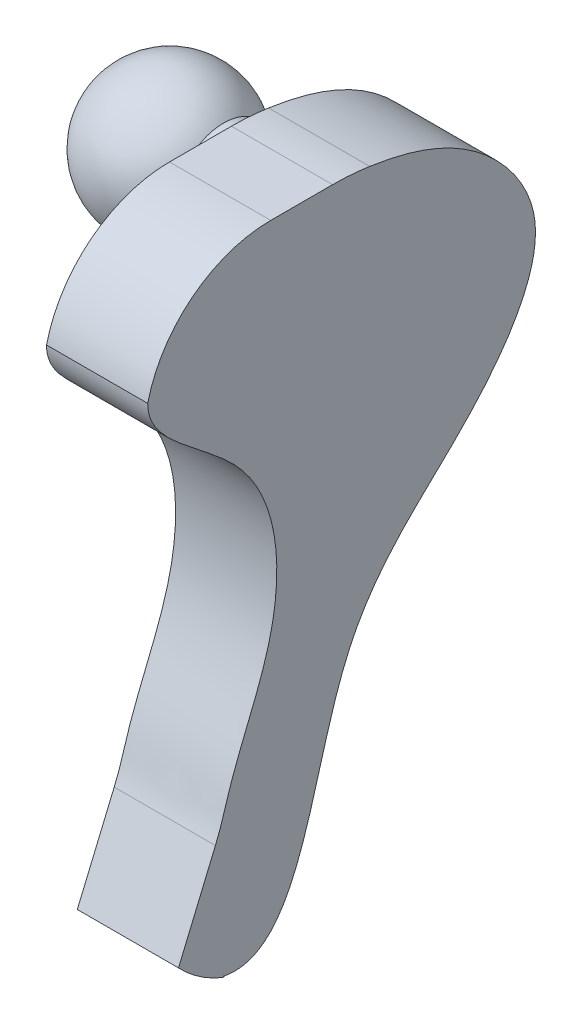
from build123d import *

# Parameters (mm, degrees)
BOSS_EXTRUDE1_DEPTH = 4
CUT_EXTRUDE3_START  = -10
CUT_EXTRUDE3_DEPTH  = 10
CUT_EXTRUDE4_DEPTH  = 10
FILLET4_START       = -1
FILLET4_DEPTH       = 6
SKETCH7_RX          = 1.83432271
SKETCH7_RY          = 1.648181576
BOSS_EXTRUDE2_DEPTH = 3
SKETCH8_R           = 1.941403724
BOSS_EXTRUDE3_DEPTH = 0.5
DOME1_FACE_RADIUS   = 1.941403724
DOME1_HEIGHT        = 5
CUT_EXTRUDE5_DEPTH  = 5


with BuildPart() as part:
    # Sketch1 → Boss-Extrude1 (new body)
    with BuildSketch(Plane(origin=(0, 0, 0), x_dir=(0, 0, -1), z_dir=(1, 0, 0))):
        with BuildLine():
            Line((6.442518848, 0), (13.409619329, 0))
            ThreePointArc((13.409619329, 0), (16.945153235, -1.464466094), (18.409619329, -5))
            Line((18.409619329, -5), (18.409619329, -20.34540211))
            ThreePointArc((18.409619329, -20.34540211), (16.945153235, -23.880936016), (13.409619329, -25.34540211))
            Line((13.409619329, -25.34540211), (6.442518848, -25.34540211))
            ThreePointArc((6.442518848, -25.34540211), (2.906984942, -23.880936016), (1.442518848, -20.34540211))
            Line((1.442518848, -20.34540211), (1.442518848, -5))
            ThreePointArc((1.442518848, -5), (2.906984942, -1.464466094), (6.442518848, 0))
        make_face()
    extrude(amount=BOSS_EXTRUDE1_DEPTH)

    # Sketch2 → Cut-Extrude3 (cut)
    with BuildSketch(Plane(origin=(4, 0, 0), x_dir=(0, 0, -1), z_dir=(1, 0, 0)).offset(CUT_EXTRUDE3_START)):
        with BuildLine():
            add(Edge.make_bspline(
                [(2.42884403, -23.286077848), (2.370716158, -22.573896831), (4.185530255, -21.12926271), (4.874517164, -17.962112227), (7.118988975, -13.802662727), (6.544049448, -7.530329658), (1.569055746, -5.349803368), (1.58046752, -3.833613753)],
                knots=[0.531334438, 0.531334438, 0.531334438, 0.531334438, 0.570400737, 0.608236932, 0.680812242, 0.778589658, 0.857107486, 0.857107486, 0.857107486, 0.857107486], degree=3))
            ThreePointArc((1.58046752, -3.833613753), (1.47712578, -4.412742239), (1.442518848, -5))
            Line((1.442518848, -5), (1.442518848, -20.34540211))
            ThreePointArc((1.442518848, -20.34540211), (1.683757797, -21.87974016), (2.384196149, -23.266021372))
            add(Edge.make_bspline(
                [(2.384196149, -23.266021372), (2.399070873, -23.272759012), (2.413953527, -23.279444568), (2.428844038, -23.286077844)],
                knots=[0.998981394, 0.998981394, 0.998981394, 0.998981394, 0.999513034, 0.999513034, 0.999513034, 0.999513034], degree=3))
        make_face()
        with BuildLine():
            Line((13.409619329, 0), (9.46398266, 0))
            add(Edge.make_bspline(
                [(9.46398266, 0), (11.207503001, -0.168664697), (14.40943711, -0.885845558), (18.093070912, -5.600973008), (14.034927819, -11.50687924), (8.23474836, -15.211494887), (7.662204752, -25.591568315), (4.542739971, -24.937885151)],
                knots=[0, 0, 0, 0, 0.077946221, 0.143334379, 0.228662798, 0.345497184, 0.490655992, 0.490655992, 0.490655992, 0.490655992], degree=3))
            add(Edge.make_bspline(
                [(4.54273997, -24.937885153), (5.749127141, -25.532851997), (7.208451258, -25.09277451), (8.521498661, -25.334156754), (8.57622256, -25.34540211)],
                knots=[0.001400322, 0.001400322, 0.001400322, 0.001400322, 0.038459748, 0.040079073, 0.040079073, 0.040079073, 0.040079073], degree=3))
            Line((8.57622256, -25.34540211), (13.409619329, -25.34540211))
            ThreePointArc((13.409619329, -25.34540211), (16.945153235, -23.880936016), (18.409619329, -20.34540211))
            Line((18.409619329, -20.34540211), (18.409619329, -5))
            ThreePointArc((18.409619329, -5), (16.945153235, -1.464466094), (13.409619329, 0))
        make_face()
        with BuildLine():
            ThreePointArc((2.906984942, -1.464466094), (4.529101686, -0.380602337), (6.442518848, 0))
            add(Edge.make_bspline(
                [(6.442518848, 0), (7.443592251, 0.121124965), (8.454170968, 0.097687179), (9.46398266, 0)],
                knots=[0.954855127, 0.954855127, 0.954855127, 0.954855127, 1, 1, 1, 1], degree=3))
            Line((9.46398266, 0), (13.409619329, 0))
            ThreePointArc((13.409619329, 0), (16.945153235, -1.464466094), (18.409619329, -5))
            Line((18.409619329, -5), (18.409619329, -20.34540211))
            ThreePointArc((18.409619329, -20.34540211), (16.945153235, -23.880936016), (13.409619329, -25.34540211))
            Line((13.409619329, -25.34540211), (8.57622256, -25.34540211))
            add(Edge.make_bspline(
                [(8.57622256, -25.34540211), (10.509849295, -25.742748085), (21.004932545, -37.507061135), (40.108036136, 7.046689321), (11.067178354, 5.045725954), (-13.182357735, 4.105959789), (-4.736766595, -20.04051671), (2.384196149, -23.266021372)],
                knots=[0.040079073, 0.040079073, 0.040079073, 0.040079073, 0.09729665, 0.409886449, 0.593670055, 0.744469586, 0.998981394, 0.998981394, 0.998981394, 0.998981394], degree=3))
            ThreePointArc((2.384196149, -23.266021372), (1.683757797, -21.87974016), (1.442518848, -20.34540211))
            Line((1.442518848, -20.34540211), (1.442518848, -5))
            ThreePointArc((1.442518848, -5), (1.47712578, -4.412742239), (1.58046752, -3.833613753))
            add(Edge.make_bspline(
                [(1.58046752, -3.833613753), (1.586363874, -3.050213083), (2.186842654, -2.121305338), (2.906984942, -1.464466094)],
                knots=[0.857107486, 0.857107486, 0.857107486, 0.857107486, 0.897676897, 0.897676897, 0.897676897, 0.897676897], degree=3))
        make_face()
    extrude(amount=CUT_EXTRUDE3_DEPTH, mode=Mode.SUBTRACT)

    # Sketch6 → Cut-Extrude4 (cut)
    with BuildSketch(Plane(origin=(4, 0, 0), x_dir=(0, 0, -1), z_dir=(1, 0, 0))):
        with BuildLine():
            add(Edge.make_bspline(
                [(6.876629539, -24.646378986), (6.348652857, -24.697603605), (5.705170416, -25.181041107), (2.967179599, -24.643973727), (6.798679283, -26.524715176), (10.198220508, -25.437781208), (7.742791771, -24.562343399), (6.876629539, -24.646378986)],
                knots=[0, 0, 0, 0, 0.142115473, 0.262842986, 0.576183637, 0.76685513, 1, 1, 1, 1], degree=3))
        make_face()
    extrude(amount=-CUT_EXTRUDE4_DEPTH, mode=Mode.SUBTRACT)

    # Fillet4: read off the stored shape, not the designer's step
    # Fillet4 outline → Fillet4 (cut)
    with BuildSketch(Plane.YZ.offset(FILLET4_START)):
        with BuildLine():
            ThreePointArc((0, -8.890200058), (-0.027061887, -9.625390775), (-0.108101078, -10.356602363))
            add(Edge.make_bspline(
                [(0, -9.46398266), (-0.028832047, -9.762025236), (-0.064132076, -10.060000995), (-0.108101078, -10.356602363)],
                knots=[0, 0, 0, 0, 0.01332436, 0.01332436, 0.01332436, 0.01332436], degree=3))
            Line((0, -9.46398266), (0, -8.890200058))
        make_face()
    extrude(amount=FILLET4_DEPTH, mode=Mode.SUBTRACT)

    # Sketch7 → Boss-Extrude2 (add)
    with BuildSketch(Plane.ZY):
        with Locations(Location((-12.079238976, -5.176946967), (0, 0, 66.52385958))):
            Ellipse(SKETCH7_RX, SKETCH7_RY)
    extrude(amount=BOSS_EXTRUDE2_DEPTH)

    # Sketch8 → Boss-Extrude3 (add)
    with BuildSketch(Plane.ZY.offset(3)):
        with Locations((-12.079238976, -5.176946967)):
            Circle(SKETCH8_R)
    extrude(amount=BOSS_EXTRUDE3_DEPTH)

    # Dome1: a dome of height H over a round flat face of radius A is a cap of a sphere of radius (A * A + H * H) / (2 * H)
    dome1_r = (DOME1_FACE_RADIUS * DOME1_FACE_RADIUS + DOME1_HEIGHT * DOME1_HEIGHT) / (2 * DOME1_HEIGHT)
    dome1_base = Plane((-3.5, -5.176946967, -12.079238976), z_dir=(-1, 0, 0))
    with Locations(dome1_base.offset(DOME1_HEIGHT - dome1_r)):
        dome1_ball = Sphere(dome1_r, mode=Mode.PRIVATE)
    add(split(dome1_ball, bisect_by=dome1_base, keep=Keep.TOP, mode=Mode.PRIVATE))

    # Sketch9 → Cut-Extrude5 (cut)
    with BuildSketch(Plane.ZY):
        with BuildLine():
            Line((-4.325838527, -20.140987675), (-2.486204677, -24.505449301))
            add(Edge.make_bspline(
                [(-2.486204677, -24.505449301), (3.73593799, -24.171685926), (-2.121854058, -16.126748366), (-4.325838527, -20.140987675)],
                knots=[0, 0, 0, 0, 1, 1, 1, 1], degree=3))
        make_face()
    extrude(amount=-CUT_EXTRUDE5_DEPTH, mode=Mode.SUBTRACT)


solid = part.part
